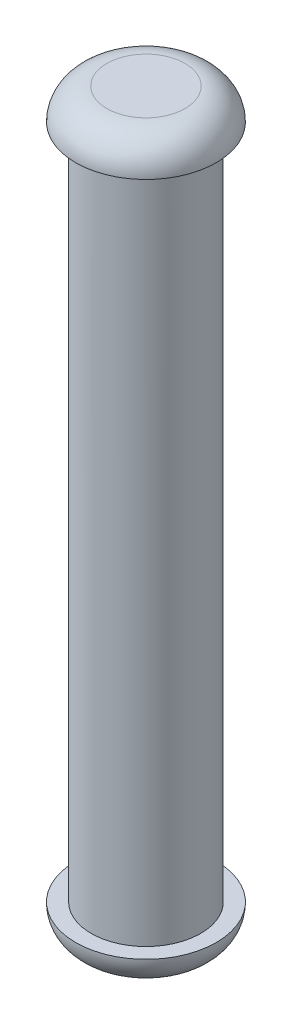
from build123d import *

# Parameters (mm, degrees)
SKETCH1_R           = 1.75
BOSS_EXTRUDE1_DEPTH = 11.3
SKETCH2_R           = 2.25
BOSS_EXTRUDE2_DEPTH = 0.5
FILLET2_R           = 1


with BuildPart() as part:
    # Sketch1 → Boss-Extrude1 (new, symmetric)
    with BuildSketch(Plane(origin=(0, 0, 0), x_dir=(1, 0, 0), z_dir=(0, 1, 0))):
        with Locations(Location((0, 0, 0), (0, 0, 270))):
            Circle(SKETCH1_R)
    extrude(amount=BOSS_EXTRUDE1_DEPTH, both=True)

    # Sketch2 → Boss-Extrude2 (add, symmetric)
    with BuildSketch(Plane(origin=(0, 11.3, 0), x_dir=(1, 0, 0), z_dir=(0, 1, 0))):
        with Locations(Location((0, 0, 0), (0, 0, 270))):
            Circle(SKETCH2_R)
    boss_extrude2 = extrude(amount=BOSS_EXTRUDE2_DEPTH, both=True)

    # Mirror1: Boss-Extrude2 across plane
    add(boss_extrude2.mirror(Plane.ZX))

    # Fillet2
    fillet2_edges = [part.edges().sort_by_distance(p)[0] for p in [
        (0, -11.8, -2.25),
        (0, 11.8, -2.25),
    ]]
    fillet(fillet2_edges, radius=FILLET2_R - 0.0001)  # a hair under: the kernel refuses the full size


solid = part.part
